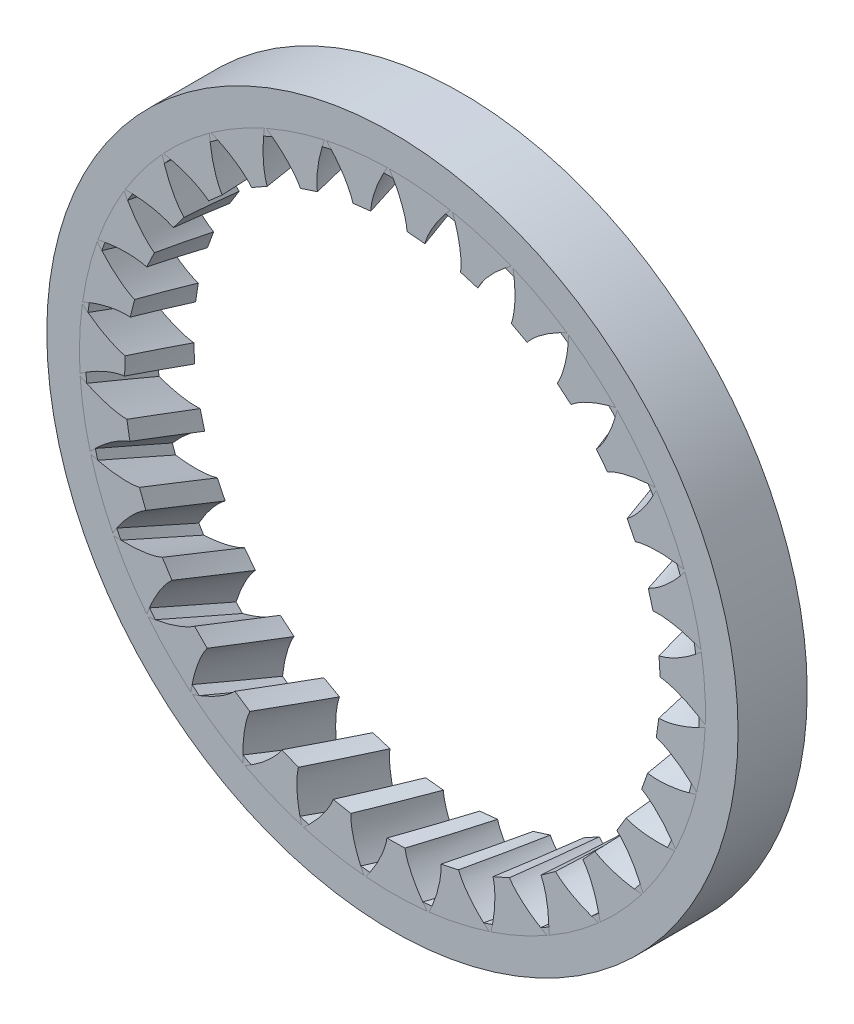
from build123d import *

# Parameters (mm, degrees)
SKETCH_1_R               = 19.994755469
SKETCH_1_R_2             = 17.744755473
EXTRUDE_1_DEPTH          = 4
SWEEP_1_PITCH            = 284.747475147
SWEEP_1_HEIGHT           = 4
SWEEP_1_RADIUS           = 16.494755473
SWEEP_1_START_ANGLE      = 90
PATTERN_CIRCULAR_1_COUNT = 31


with BuildPart() as part:
    # 草图1 → 凸台-拉伸1 (new body)
    with BuildSketch(Plane.XY):
        Circle(SKETCH_1_R)
        Circle(SKETCH_1_R_2, mode=Mode.SUBTRACT)
    extrude(amount=EXTRUDE_1_DEPTH)

    # 扫描1: sweep along a helix
    with BuildLine() as sweep_1_path:
        add(Helix(SWEEP_1_PITCH, SWEEP_1_HEIGHT, SWEEP_1_RADIUS, center=(0, 0, 0), direction=(0, 0, 1), lefthand=True, mode=Mode.PRIVATE).rotate(Axis((0, 0, 0), (0, 0, 1)), SWEEP_1_START_ANGLE))
    # 草图2 → 扫描1 (sweep)
    with BuildSketch(Plane.XY):
        with BuildLine():
            ThreePointArc((0.518386849, 15.484977193), (0, 15.493651719), (-0.518386849, 15.484977193))
            add(Edge.make_bspline(
                [(-0.518386849, 15.484977193), (-0.528633089, 15.550283176), (-0.546261734, 15.636259429), (-0.57322519, 15.74436805), (-0.591805586, 15.812992649), (-0.613477915, 15.887138436), (-0.638470566, 15.966706681), (-0.667008106, 16.051591934), (-0.699312487, 16.141681888), (-0.735602445, 16.23685752), (-0.776093445, 16.336993153), (-0.820997464, 16.441956542), (-0.870522829, 16.55160897), (-0.924874035, 16.665805335), (-0.984251582, 16.784394255), (-1.048851797, 16.907218164), (-1.118866673, 17.034113427), (-1.194483706, 17.164910443), (-1.275885725, 17.299433768), (-1.363250756, 17.437502227), (-1.456751793, 17.578929047), (-1.592155444, 17.775095391), (-1.699988704, 17.921555183), (-1.774981432, 18.019395503)],
                knots=[0, 0, 0, 0, 0.069452079, 0.09220614, 0.117115975, 0.144181585, 0.173402969, 0.204780128, 0.238313061, 0.274001769, 0.311846251, 0.351846508, 0.394002539, 0.438314345, 0.484781925, 0.53340528, 0.584184409, 0.637119313, 0.692209991, 0.749456444, 0.808858671, 0.870416673, 1, 1, 1, 1], degree=3))
            ThreePointArc((-1.774981432, 18.019395503), (0, 18.106605794), (1.774981432, 18.019395503))
            add(Edge.make_bspline(
                [(0.518386849, 15.484977193), (0.528633089, 15.550283176), (0.546261734, 15.636259429), (0.57322519, 15.74436805), (0.591805586, 15.812992649), (0.613477915, 15.887138436), (0.638470566, 15.966706681), (0.667008106, 16.051591934), (0.699312487, 16.141681888), (0.735602445, 16.23685752), (0.776093445, 16.336993153), (0.820997464, 16.441956542), (0.870522829, 16.55160897), (0.924874035, 16.665805335), (0.984251582, 16.784394255), (1.048851797, 16.907218164), (1.118866673, 17.034113427), (1.194483706, 17.164910443), (1.275885725, 17.299433768), (1.363250756, 17.437502227), (1.456751793, 17.578929047), (1.592155444, 17.775095391), (1.699988704, 17.921555183), (1.774981432, 18.019395503)],
                knots=[0, 0, 0, 0, 0.069452079, 0.09220614, 0.117115975, 0.144181585, 0.173402969, 0.204780128, 0.238313061, 0.274001769, 0.311846251, 0.351846508, 0.394002539, 0.438314345, 0.484781925, 0.53340528, 0.584184409, 0.637119313, 0.692209991, 0.749456444, 0.808858671, 0.870416673, 1, 1, 1, 1], degree=3))
        make_face()
    sweep_1 = sweep(path=sweep_1_path.line, is_frenet=True)

    # 阵列(圆周)1: 扫描1 ×31 about axis
    pattern_circular_1_axis = Axis((0, 0, -0.2), (0, 0, 1))
    for i in range(1, PATTERN_CIRCULAR_1_COUNT):
        add(sweep_1.rotate(pattern_circular_1_axis, i * 360 / PATTERN_CIRCULAR_1_COUNT))


solid = part.part
